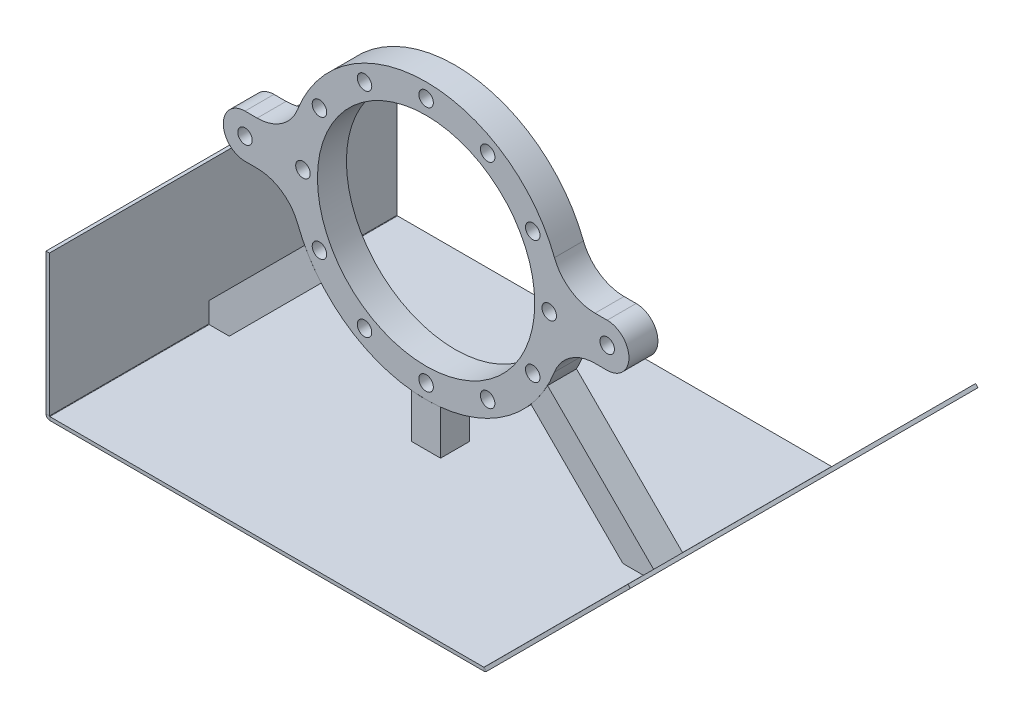
from build123d import *

# Parameters (mm, degrees)
SKETCH1_R                                      = 241.3
SKETCH1_R_2                                    = 190.5
SKETCH1_R_3                                    = 12.7
BOSS_EXTRUDE1_DEPTH                            = 50.8
SKETCH18_W                                     = 50.8
SKETCH18_H                                     = 50.8
SKETCH18_W_2                                   = 38.1
SKETCH18_H_2                                   = 38.1
AL_TUBE_SQUARE_AL_TUBE_2_SQR_X_0_25_WALL_DEPTH = 127
SKETCH18_ON_SEGMENT_2_W                        = 50.8
SKETCH18_ON_SEGMENT_2_H                        = 50.8
SKETCH18_ON_SEGMENT_2_W_2                      = 38.1
SKETCH18_ON_SEGMENT_2_H_2                      = 38.1
AL_TUBE_SQUARE_AL_TUBE_2_SQR_X_0_25_2_DEPTH    = 308.781363997
SKETCH18_ON_SEGMENT_3_W                        = 50.8
SKETCH18_ON_SEGMENT_3_H                        = 50.8
SKETCH18_ON_SEGMENT_3_W_2                      = 38.1
SKETCH18_ON_SEGMENT_3_H_2                      = 38.1
AL_TUBE_SQUARE_AL_TUBE_2_SQR_X_0_25_3_DEPTH    = 308.781363997
INDENT1_DEPTH                                  = 50.8
INDENT1_2_DEPTH                                = 50.8
INDENT1_3_DEPTH                                = 6.35
INDENT1_START                                  = 44.45
INDENT1_4_DEPTH                                = 6.35
INDENT1_5_OUTLINE_R                            = 12.7
INDENT1_5_DEPTH                                = 6.35
INDENT1_6_OUTLINE_R                            = 12.7
INDENT1_6_DEPTH                                = 6.35
INDENT1_START_2                                = 6.35
INDENT1_7_DEPTH                                = 38.1
INDENT2_DEPTH                                  = 50.8
INDENT2_START                                  = 44.45
INDENT2_2_OUTLINE_R                            = 12.7
INDENT2_2_DEPTH                                = 6.35
INDENT2_3_OUTLINE_R                            = 12.7
INDENT2_3_DEPTH                                = 6.35
INDENT3_DEPTH                                  = 50.8
INDENT3_2_OUTLINE_R                            = 12.7
INDENT3_2_DEPTH                                = 6.35
INDENT3_START                                  = 44.45
INDENT3_3_OUTLINE_R                            = 12.7
INDENT3_3_DEPTH                                = 6.35
INDENT3_START_2                                = 6.35
INDENT3_4_DEPTH                                = 38.1
INDENT3_5_DEPTH                                = 50.8
INDENT3_6_DEPTH                                = 6.35
INDENT3_7_DEPTH                                = 6.35
SKETCH19_W                                     = 762
SKETCH19_H                                     = 609.6
BASE_FLANGE1_DEPTH                             = 6
EDGE_FLANGE1_STRIP_CUT_DEPTH                   = 609.6
EDGE_FLANGE1_DEPTH                             = 609.6
EDGE_FLANGE2_STRIP_W                           = 25.4732
EDGE_FLANGE2_STRIP_H                           = 6
EDGE_FLANGE2_STRIP_CUT_DEPTH                   = 609.6
EDGE_FLANGE2_DEPTH                             = 609.6
INDENT4_DEPTH                                  = 50.8
INDENT4_2_DEPTH                                = 50.8
INDENT4_3_DEPTH                                = 6.35
INDENT4_START                                  = 44.45
INDENT4_4_DEPTH                                = 6.35
INDENT5_DEPTH                                  = 50.8
INDENT5_2_DEPTH                                = 50.8
INDENT5_3_DEPTH                                = 6.35
INDENT5_START                                  = 44.45
INDENT5_4_DEPTH                                = 6.35
INDENT5_5_DEPTH                                = 50.8
INDENT5_6_DEPTH                                = 6.35
INDENT5_7_DEPTH                                = 6.35
BOSS_EXTRUDE2_START                            = -50.8
SKETCH30_R                                     = 38.1
SKETCH30_R_2                                   = 12.7
BOSS_EXTRUDE2_DEPTH                            = 50.8
FILLET1_R                                      = 76.2


# Read off the part's stored shape, not the designer's step: Indent1, Indent2, Indent3, Indent4, Indent5
# Sheet-metal steps are written as plain solids
with BuildPart() as part:
    # Sketch1 → Boss-Extrude1 (new body)
    with BuildSketch(Plane.XY):
        Circle(SKETCH1_R)
        Circle(SKETCH1_R_2, mode=Mode.SUBTRACT)
        with Locations((0, 215.9)):
            Circle(SKETCH1_R_3, mode=Mode.SUBTRACT)
        with Locations((107.95, 186.974884677)):
            Circle(SKETCH1_R_3, mode=Mode.SUBTRACT)
        with Locations((186.974884677, 107.95)):
            Circle(SKETCH1_R_3, mode=Mode.SUBTRACT)
        with Locations((215.9, 0)):
            Circle(SKETCH1_R_3, mode=Mode.SUBTRACT)
        with Locations((186.974884677, -107.95)):
            Circle(SKETCH1_R_3, mode=Mode.SUBTRACT)
        with Locations((107.95, -186.974884677)):
            Circle(SKETCH1_R_3, mode=Mode.SUBTRACT)
        with Locations((0, -215.9)):
            Circle(SKETCH1_R_3, mode=Mode.SUBTRACT)
        with Locations((-107.95, -186.974884677)):
            Circle(SKETCH1_R_3, mode=Mode.SUBTRACT)
        with Locations((-186.974884677, -107.95)):
            Circle(SKETCH1_R_3, mode=Mode.SUBTRACT)
        with Locations((-215.9, 0)):
            Circle(SKETCH1_R_3, mode=Mode.SUBTRACT)
        with Locations((-186.974884677, 107.95)):
            Circle(SKETCH1_R_3, mode=Mode.SUBTRACT)
        with Locations((-107.95, 186.974884677)):
            Circle(SKETCH1_R_3, mode=Mode.SUBTRACT)
    extrude(amount=BOSS_EXTRUDE1_DEPTH)

    # Sketch30 → Boss-Extrude2 (add)
    # profile 1 of 4: a face of its own
    with BuildSketch(Plane.XY.offset(50.8).offset(BOSS_EXTRUDE2_START)):
        with BuildLine():
            ThreePointArc((-238.273120599, -38.1), (-241.3, 0), (-238.273120599, 38.1))
            Line((-238.273120599, 38.1), (-317.5, 38.1))
            ThreePointArc((-317.5, 38.1), (-290.559231637, 26.940768363), (-279.4, 0))
            ThreePointArc((-279.4, 0), (-290.559231637, -26.940768363), (-317.5, -38.1))
            Line((-317.5, -38.1), (-238.273120599, -38.1))
        make_face()
    # profile 2 of 4: a face of its own
    with BuildSketch(Plane.XY.offset(50.8).offset(BOSS_EXTRUDE2_START)):
        with Locations((-317.5, 0)):
            Circle(SKETCH30_R)
        with Locations((-317.5, 0)):
            Circle(SKETCH30_R_2, mode=Mode.SUBTRACT)
    # profile 3 of 4: a face of its own
    with BuildSketch(Plane.XY.offset(50.8).offset(BOSS_EXTRUDE2_START)):
        with BuildLine():
            ThreePointArc((317.5, -38.1), (279.4, 0), (317.5, 38.1))
            Line((317.5, 38.1), (238.273120599, 38.1))
            ThreePointArc((238.273120599, 38.1), (240.542089873, 19.110023541), (241.3, 0))
            ThreePointArc((241.3, 0), (240.542089873, -19.110023541), (238.273120599, -38.1))
            Line((238.273120599, -38.1), (317.5, -38.1))
        make_face()
    # profile 4 of 4: a face of its own
    with BuildSketch(Plane.XY.offset(50.8).offset(BOSS_EXTRUDE2_START)):
        with Locations((317.5, 0)):
            Circle(SKETCH30_R)
        with Locations((317.5, 0)):
            Circle(SKETCH30_R_2, mode=Mode.SUBTRACT)
    extrude(amount=BOSS_EXTRUDE2_DEPTH)

    # Fillet1
    fillet1_edges = [part.edges().sort_by_distance(p)[0] for p in [
        (-238.273120599, 38.1, 25.4),
        (-238.273120599, -38.1, 25.4),
        (238.273120599, 38.1, 25.4),
        (238.273120599, -38.1, 25.4),
    ]]
    fillet(fillet1_edges, radius=FILLET1_R)


with BuildPart() as body_2:
    # Sketch18 → Al tube square AL TUBE 2 SQR X 0.25 WALL(1) (new body)
    with BuildSketch(Plane(origin=(0, -190.5, 25.4), x_dir=(-1, 0, 0), z_dir=(0, -1, 0))):
        Rectangle(SKETCH18_W, SKETCH18_H)
        Rectangle(SKETCH18_W_2, SKETCH18_H_2, mode=Mode.SUBTRACT)
    extrude(amount=AL_TUBE_SQUARE_AL_TUBE_2_SQR_X_0_25_WALL_DEPTH)

    # Indent2 outline → Indent2 (cut)
    with BuildSketch(Plane.XY):
        with BuildLine():
            Line((25.4, -239.959434072), (25.4, -190.5))
            Line((25.4, -190.5), (-25.4, -190.5))
            Line((-25.4, -190.5), (-25.4, -239.959434072))
            ThreePointArc((-25.4, -239.959434072), (0, -241.3), (25.4, -239.959434072))
        make_face()
    extrude(amount=INDENT2_DEPTH, mode=Mode.SUBTRACT)


with BuildPart() as body_3:
    # Sketch18 on segment 2 (carried to segment 2) → Al tube square AL TUBE 2 SQR X 0.25  2 (new body)
    with BuildSketch(Plane(origin=(381, -317.5, 25.4), x_dir=(0.707106781, 0.707106781, 0), z_dir=(-0.707106781, 0.707106781, 0))):
        Rectangle(SKETCH18_ON_SEGMENT_2_W, SKETCH18_ON_SEGMENT_2_H)
        Rectangle(SKETCH18_ON_SEGMENT_2_W_2, SKETCH18_ON_SEGMENT_2_H_2, mode=Mode.SUBTRACT)
    extrude(amount=AL_TUBE_SQUARE_AL_TUBE_2_SQR_X_0_25_2_DEPTH)

    # Indent1 outline → Indent1 (cut)
    with BuildSketch(Plane.XY):
        with BuildLine():
            Line((212.933396583, -113.512372099), (180.619115855, -81.198091371))
            Line((180.619115855, -81.198091371), (144.698091371, -117.119115855))
            Line((144.698091371, -117.119115855), (183.856224739, -156.277249223))
            ThreePointArc((183.856224739, -156.277249223), (199.543753538, -135.676012706), (212.933396583, -113.512372099))
        make_face()
    extrude(amount=INDENT1_DEPTH, mode=Mode.SUBTRACT)

    # Indent4 outline → Indent4 (cut)
    with BuildSketch(Plane.XY):
        with BuildLine():
            ThreePointArc((381.215745145, -317.284254855), (380.976774906, -317.443929664), (380.69489029, -317.5))
            Line((380.69489029, -317.5), (345.078975516, -317.5))
            Line((345.078975516, -317.5), (363.039487758, -335.460512242))
            Line((363.039487758, -335.460512242), (381.215745145, -317.284254855))
        make_face()
    extrude(amount=INDENT4_DEPTH, mode=Mode.SUBTRACT)


with BuildPart() as body_4:
    # Sketch18 on segment 3 (carried to segment 3) → Al tube square AL TUBE 2 SQR X 0.25  3 (new body)
    with BuildSketch(Plane(origin=(-381, -317.5, 25.4), x_dir=(0.707106781, -0.707106781, 0), z_dir=(0.707106781, 0.707106781, 0))):
        Rectangle(SKETCH18_ON_SEGMENT_3_W, SKETCH18_ON_SEGMENT_3_H)
        Rectangle(SKETCH18_ON_SEGMENT_3_W_2, SKETCH18_ON_SEGMENT_3_H_2, mode=Mode.SUBTRACT)
    extrude(amount=AL_TUBE_SQUARE_AL_TUBE_2_SQR_X_0_25_3_DEPTH)

    # Indent3 outline → Indent3 (cut)
    with BuildSketch(Plane.XY):
        with BuildLine():
            Line((-183.856224739, -156.277249223), (-144.698091371, -117.119115856))
            Line((-144.698091371, -117.119115856), (-180.619115855, -81.198091371))
            Line((-180.619115855, -81.198091371), (-212.933396583, -113.512372099))
            ThreePointArc((-212.933396583, -113.512372099), (-199.543753538, -135.676012706), (-183.856224739, -156.277249223))
        make_face()
    extrude(amount=INDENT3_DEPTH, mode=Mode.SUBTRACT)

    # Indent5 outline → Indent5 (cut)
    with BuildSketch(Plane.XY):
        with BuildLine():
            ThreePointArc((-380.2634, -317.5), (-380.784254855, -317.284254855), (-381, -316.7634))
            Line((-381, -316.7634), (-381, -281.578975516))
            Line((-381, -281.578975516), (-398.960512242, -299.539487758))
            Line((-398.960512242, -299.539487758), (-363.039487758, -335.460512242))
            Line((-363.039487758, -335.460512242), (-345.078975516, -317.5))
            Line((-345.078975516, -317.5), (-380.2634, -317.5))
        make_face()
    extrude(amount=INDENT5_DEPTH, mode=Mode.SUBTRACT)


with BuildPart() as body_5:
    # Indent1 2 outline → Indent1 2 (new body)
    with BuildSketch(Plane.XY):
        with BuildLine():
            Line((151.737401824, -115.178170187), (149.188219432, -112.628987795))
            Line((149.188219432, -112.628987795), (144.698091371, -117.119115855))
            Line((144.698091371, -117.119115855), (147.785663179, -120.206687663))
            ThreePointArc((147.785663179, -120.206687663), (149.782636224, -117.709013613), (151.737401824, -115.178170187))
        make_face()
    extrude(amount=INDENT1_2_DEPTH)

    # Indent1 3 outline → Indent1 3 (add)
    with BuildSketch(Plane.XY):
        with BuildLine():
            ThreePointArc((151.737401824, -115.178170187), (157.401933555, -107.307414995), (162.658603613, -99.158603613))
            Line((162.658603613, -99.158603613), (149.188219432, -112.628987795))
            Line((149.188219432, -112.628987795), (151.737401824, -115.178170187))
        make_face()
    extrude(amount=INDENT1_3_DEPTH)

    # Indent1 4 outline → Indent1 4 (add)
    with BuildSketch(Plane.XY.offset(INDENT1_START)):
        with BuildLine():
            ThreePointArc((151.737401824, -115.178170187), (157.401933555, -107.307414995), (162.658603613, -99.158603613))
            Line((162.658603613, -99.158603613), (149.188219432, -112.628987795))
            Line((149.188219432, -112.628987795), (151.737401824, -115.178170187))
        make_face()
    extrude(amount=INDENT1_4_DEPTH)


with BuildPart() as body_6:
    # Indent1 5 outline → Indent1 5 (new body)
    with BuildSketch(Plane.XY):
        with Locations((186.974884677, -107.95)):
            Circle(INDENT1_5_OUTLINE_R)
    extrude(amount=INDENT1_5_DEPTH)

    # Indent1 6 outline → Indent1 6 (add)
    with BuildSketch(Plane.XY.offset(INDENT1_START)):
        with Locations((186.974884677, -107.95)):
            Circle(INDENT1_6_OUTLINE_R)
    extrude(amount=INDENT1_6_DEPTH)

    # Indent1 7 outline → Indent1 7 (add)
    with BuildSketch(Plane.XY.offset(INDENT1_START_2)):
        with BuildLine():
            ThreePointArc((199.615675856, -109.174907493), (195.955140798, -98.969743879), (185.749977184, -95.309208821))
            Line((185.749977184, -95.309208821), (199.615675856, -109.174907493))
        make_face()
    extrude(amount=INDENT1_7_DEPTH)


with BuildPart() as body_5_2:
    # Indent2 2 outline → Indent2 2 (new body)
    with BuildSketch(Plane.XY.offset(INDENT2_START)):
        with Locations((0, -215.9)):
            Circle(INDENT2_2_OUTLINE_R)
    extrude(amount=INDENT2_2_DEPTH)


with BuildPart() as body_6_2:
    # Indent2 3 outline → Indent2 3 (new body)
    with BuildSketch(Plane.XY):
        with Locations((0, -215.9)):
            Circle(INDENT2_3_OUTLINE_R)
    extrude(amount=INDENT2_3_DEPTH)


with BuildPart() as body_5_3:
    # Indent3 2 outline → Indent3 2 (new body)
    with BuildSketch(Plane.XY):
        with Locations((-186.974884677, -107.95)):
            Circle(INDENT3_2_OUTLINE_R)
    extrude(amount=INDENT3_2_DEPTH)

    # Indent3 3 outline → Indent3 3 (add)
    with BuildSketch(Plane.XY.offset(INDENT3_START)):
        with Locations((-186.974884677, -107.95)):
            Circle(INDENT3_3_OUTLINE_R)
    extrude(amount=INDENT3_3_DEPTH)

    # Indent3 4 outline → Indent3 4 (add)
    with BuildSketch(Plane.XY.offset(INDENT3_START_2)):
        with BuildLine():
            Line((-199.615675856, -109.174907493), (-185.749977184, -95.309208821))
            ThreePointArc((-185.749977184, -95.309208821), (-195.955140798, -98.969743879), (-199.615675856, -109.174907493))
        make_face()
    extrude(amount=INDENT3_4_DEPTH)


with BuildPart() as body_6_3:
    # Indent3 5 outline → Indent3 5 (new body)
    with BuildSketch(Plane.XY):
        with BuildLine():
            Line((-147.785663179, -120.206687663), (-144.698091371, -117.119115856))
            Line((-144.698091371, -117.119115856), (-149.188219432, -112.628987795))
            Line((-149.188219432, -112.628987795), (-151.737401824, -115.178170187))
            ThreePointArc((-151.737401824, -115.178170187), (-149.782636224, -117.709013613), (-147.785663179, -120.206687663))
        make_face()
    extrude(amount=INDENT3_5_DEPTH)

    # Indent3 6 outline → Indent3 6 (add)
    with BuildSketch(Plane.XY):
        with BuildLine():
            Line((-151.737401824, -115.178170187), (-149.188219432, -112.628987795))
            Line((-149.188219432, -112.628987795), (-162.658603613, -99.158603613))
            ThreePointArc((-162.658603613, -99.158603613), (-157.401933555, -107.307414995), (-151.737401824, -115.178170187))
        make_face()
    extrude(amount=INDENT3_6_DEPTH)

    # Indent3 7 outline → Indent3 7 (add)
    with BuildSketch(Plane.XY.offset(INDENT3_START)):
        with BuildLine():
            Line((-151.737401824, -115.178170187), (-149.188219432, -112.628987795))
            Line((-149.188219432, -112.628987795), (-162.658603613, -99.158603613))
            ThreePointArc((-162.658603613, -99.158603613), (-157.401933555, -107.307414995), (-151.737401824, -115.178170187))
        make_face()
    extrude(amount=INDENT3_7_DEPTH)


with BuildPart() as body_5_4:
    # Sketch19 → Base-Flange1 (new body)
    with BuildSketch(Plane(origin=(0, -317.5, 0), x_dir=(1, 0, 0), z_dir=(0, 1, 0))):
        with Locations((0, -25.4)):
            Rectangle(SKETCH19_W, SKETCH19_H)
    extrude(amount=-BASE_FLANGE1_DEPTH)

    # Edge-Flange1 strip (across the edge) → Edge-Flange1 strip cut (cut)
    with BuildSketch(Plane(origin=(381, -317.5, 330.2), x_dir=(-0.7071067811865438, 0.7071067811865512, 0), z_dir=(0, 0, -1))):
        Polygon((-22.039168001, 13.553886626), (-4.026895542, -4.458385832), (0.215745145, -0.215745145), (-17.796527314, 17.796527314), align=None)
    extrude(amount=EDGE_FLANGE1_STRIP_CUT_DEPTH, mode=Mode.SUBTRACT)

    # Edge-Flange1 section (across the edge) → Edge-Flange1 (add)
    with BuildSketch(Plane(origin=(381, -317.5, 330.2), x_dir=(-0.7071067811865438, 0.7071067811865512, 0), z_dir=(0, 0, -1))):
        with BuildLine():
            Line((-6, 0.30510971), (-6, 356.670718626))
            Line((-6, 356.670718626), (0, 356.670718626))
            Line((0, 356.670718626), (0, 0.30510971))
            ThreePointArc((0, 0.30510971), (0.056070336, 0.023225094), (0.215745145, -0.215745145))
            Line((0.215745145, -0.215745145), (-4.026895542, -4.458385832))
            ThreePointArc((-4.026895542, -4.458385832), (-5.487206859, -2.2728755), (-6, 0.30510971))
        make_face()
    extrude(amount=EDGE_FLANGE1_DEPTH)

    # Edge-Flange2 strip (across the edge) → Edge-Flange2 strip cut (cut)
    with BuildSketch(Plane(origin=(-381, -317.5, -279.4), x_dir=(1, 0, 0), z_dir=(0, 0, 1))):
        with Locations((-12, -3)):
            Rectangle(EDGE_FLANGE2_STRIP_W, EDGE_FLANGE2_STRIP_H)
    extrude(amount=EDGE_FLANGE2_STRIP_CUT_DEPTH, mode=Mode.SUBTRACT)

    # Edge-Flange2 section (across the edge) → Edge-Flange2 (add)
    with BuildSketch(Plane(origin=(-381, -317.5, -279.4), x_dir=(1, 0, 0), z_dir=(0, 0, 1))):
        with BuildLine():
            Line((-6, 0.7366), (-6, 248))
            Line((-6, 248), (0, 248))
            Line((0, 248), (0, 0.7366))
            ThreePointArc((0, 0.7366), (0.215745145, 0.215745145), (0.7366, 0))
            Line((0.7366, 0), (0.7366, -6))
            ThreePointArc((0.7366, -6), (-4.026895542, -4.026895542), (-6, 0.7366))
        make_face()
    extrude(amount=EDGE_FLANGE2_DEPTH)


with BuildPart() as body_6_4:
    # Indent4 2 outline → Indent4 2 (new body)
    with BuildSketch(Plane.XY):
        Polygon((363.039487758, -335.460512242), (367.529615818, -330.970384182), (360.059231637, -323.5), (351.078975516, -323.5), align=None)
    extrude(amount=INDENT4_2_DEPTH)

    # Indent4 3 outline → Indent4 3 (add)
    with BuildSketch(Plane.XY):
        Polygon((367.529615818, -330.970384182), (375, -323.5), (360.059231637, -323.5), align=None)
    extrude(amount=INDENT4_3_DEPTH)

    # Indent4 4 outline → Indent4 4 (add)
    with BuildSketch(Plane.XY.offset(INDENT4_START)):
        Polygon((367.529615818, -330.970384182), (375, -323.5), (360.059231637, -323.5), align=None)
    extrude(amount=INDENT4_4_DEPTH)


with BuildPart() as body_6_5:
    # Indent5 2 outline → Indent5 2 (new body)
    with BuildSketch(Plane.XY):
        Polygon((-367.529615818, -330.970384182), (-363.039487758, -335.460512242), (-351.078975516, -323.5), (-360.059231637, -323.5), align=None)
    extrude(amount=INDENT5_2_DEPTH)

    # Indent5 3 outline → Indent5 3 (add)
    with BuildSketch(Plane.XY):
        Polygon((-375, -323.5), (-367.529615818, -330.970384182), (-360.059231637, -323.5), align=None)
    extrude(amount=INDENT5_3_DEPTH)

    # Indent5 4 outline → Indent5 4 (add)
    with BuildSketch(Plane.XY.offset(INDENT5_START)):
        Polygon((-375, -323.5), (-367.529615818, -330.970384182), (-360.059231637, -323.5), align=None)
    extrude(amount=INDENT5_4_DEPTH)


with BuildPart() as body_7:
    # Indent5 5 outline → Indent5 5 (new body)
    with BuildSketch(Plane.XY):
        Polygon((-398.960512242, -299.539487758), (-394.470384182, -304.029615818), (-387, -296.559231637), (-387, -287.578975516), align=None)
    extrude(amount=INDENT5_5_DEPTH)

    # Indent5 6 outline → Indent5 6 (add)
    with BuildSketch(Plane.XY):
        Polygon((-394.470384182, -304.029615818), (-387, -311.5), (-387, -296.559231637), align=None)
    extrude(amount=INDENT5_6_DEPTH)

    # Indent5 7 outline → Indent5 7 (add)
    with BuildSketch(Plane.XY.offset(INDENT5_START)):
        Polygon((-394.470384182, -304.029615818), (-387, -311.5), (-387, -296.559231637), align=None)
    extrude(amount=INDENT5_7_DEPTH)


solid = Compound([part.part, body_2.part, body_3.part, body_4.part, body_5_4.part])
